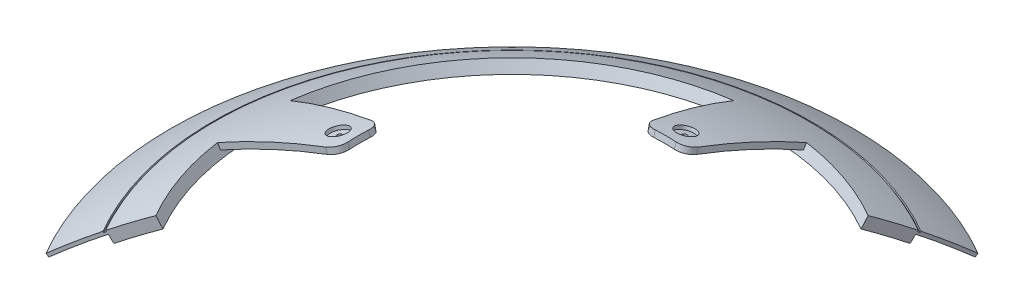
from build123d import *
from build123d.topology import SkipClean

# Parameters (mm, degrees)
REVOLVE1_ANGLE           = 30
REVOLVE1_OTHER_WAY_ANGLE = 120
REVOLVE2_ANGLE           = 15
CIRPATTERN1_COUNT        = 4
REVOLVE4_ANGLE           = 16
CUT_REVOLVE4_START       = -250
CUT_REVOLVE4_OUTLINE_R   = 4
CUT_REVOLVE4_DEPTH       = 1.5
CUT_REVOLVE4_START_2     = -248.5
CUT_REVOLVE4_2_OUTLINE_R = 1
CUT_REVOLVE4_2_DEPTH     = 1.00202
FILLET2_R                = 5
CIRPATTERN5_COUNT        = 2
CIRPATTERN5_ANGLE        = 90
FILLET2_OF_CIRPATTERN5_R = 5


# Read off the part's stored shape, not the designer's step: Revolve2, Revolve4, Cut-Revolve4
with BuildPart() as part:
    # Sketch1 → Revolve1 (revolve)
    with BuildSketch(Plane.XY):
        with BuildLine():
            ThreePointArc((-142.533744, 203.559283), (-133.518953, 209.582774), (-124.25, 215.207313))
            Line((-124.25, 215.207313), (-125, 216.506351))
            ThreePointArc((-125, 216.506351), (-134.324902, 210.847861), (-143.394109, 204.788011))
            Line((-143.394109, 204.788011), (-142.533744, 203.559283))
        make_face()
        with BuildLine():
            ThreePointArc((-124.25, 215.207313), (-64.316533, 240.032568), (0, 248.5))
            Line((0, 248.5), (0, 250))
            ThreePointArc((0, 250), (-64.704761, 241.481457), (-125, 216.506351))
            Line((-125, 216.506351), (-124.25, 215.207313))
        make_face()
        with BuildLine():
            ThreePointArc((-122.5, 212.176224), (-63.410666, 236.651827), (0, 245))
            Line((0, 245), (0, 248.5))
            ThreePointArc((0, 248.5), (-64.316533, 240.032568), (-124.25, 215.207313))
            Line((-124.25, 215.207313), (-122.5, 212.176224))
        make_face()
    revolve(axis=Axis((0, 0, 0), (0, 1, 0)), revolution_arc=REVOLVE1_ANGLE)

    # Sketch1 → Revolve1 other way (revolve)
    with SkipClean():  # the faces are left unmerged after this step: merging them gives an invalid solid
        with BuildSketch(Plane.XY):
            with BuildLine():
                ThreePointArc((-142.533744, 203.559283), (-133.518953, 209.582774), (-124.25, 215.207313))
                Line((-124.25, 215.207313), (-125, 216.506351))
                ThreePointArc((-125, 216.506351), (-134.324902, 210.847861), (-143.394109, 204.788011))
                Line((-143.394109, 204.788011), (-142.533744, 203.559283))
            make_face()
            with BuildLine():
                ThreePointArc((-124.25, 215.207313), (-64.316533, 240.032568), (0, 248.5))
                Line((0, 248.5), (0, 250))
                ThreePointArc((0, 250), (-64.704761, 241.481457), (-125, 216.506351))
                Line((-125, 216.506351), (-124.25, 215.207313))
            make_face()
            with BuildLine():
                ThreePointArc((-122.5, 212.176224), (-63.410666, 236.651827), (0, 245))
                Line((0, 245), (0, 248.5))
                ThreePointArc((0, 248.5), (-64.316533, 240.032568), (-124.25, 215.207313))
                Line((-124.25, 215.207313), (-122.5, 212.176224))
            make_face()
        revolve(axis=Axis((0, 0, 0), (0, -1, 0)), revolution_arc=REVOLVE1_OTHER_WAY_ANGLE)

    # Revolve2 outline → Revolve2 (revolve)
    with SkipClean():  # the faces are left unmerged after this step: merging them gives an invalid solid
        with BuildSketch(Plane(origin=(0, 0, 0), x_dir=(-0.9914448613738103, 0, -0.13052619222005243), z_dir=(0.13052619222005243, 0, -0.9914448613738103))):
            with BuildLine():
                Line((133.4007, 205.497575), (135.306424, 208.433255))
                Line((135.306424, 208.433255), (135.306424, 209.582774))
                Line((135.306424, 209.582774), (133.518953, 209.582774))
                Line((133.518953, 209.582774), (132.713003, 208.317687))
                ThreePointArc((132.713003, 208.317687), (130.890058, 209.46788), (129.057145, 210.602121))
                Line((129.057145, 210.602121), (128.012148, 208.89684))
                ThreePointArc((128.012148, 208.89684), (130.717474, 207.214724), (133.4007, 205.497575))
            make_face()
        revolve2 = revolve(axis=Axis((0, 0, 0), (0, 1, 0)), revolution_arc=REVOLVE2_ANGLE)

    # CirPattern1: Revolve2 ×4 about axis, 2 skipped
    with SkipClean():  # the faces are left unmerged after this step: merging them gives an invalid solid
        cirpattern1_axis = Axis((0, 0, 0), (0, -1, 0))
        add([revolve2.rotate(cirpattern1_axis, i * 360 / CIRPATTERN1_COUNT) for i in range(1, CIRPATTERN1_COUNT) if i not in (2, 3)])

    # Sketch4 → Cut-Revolve1 (revolve, cut)
    with BuildSketch(Plane.XY):
        with BuildLine():
            Line((0, 250), (0, 0))
            Line((0, 0), (109.592787, 224.698512))
            ThreePointArc((109.592787, 224.698512), (56.237764, 243.592516), (0, 250))
        make_face()
    revolve(axis=Axis((0, 0, 0), (0, 1, 0)), mode=Mode.SUBTRACT)

    # Revolve4 outline → Revolve4 (revolve)
    with BuildSketch(Plane(origin=(0, 0, 0), x_dir=(-0.9902680687415703, 0, -0.13917310096006574), z_dir=(0.13917310096006574, 0, -0.9902680687415703))):
        with BuildLine():
            Line((108.496859, 222.451526), (114.084698, 222.451526))
            ThreePointArc((114.084698, 222.451526), (89.899679, 233.276762), (64.704761, 241.481457))
            Line((64.704761, 241.481457), (64.057714, 239.066642))
            ThreePointArc((64.057714, 239.066642), (86.676327, 231.826367), (108.496859, 222.451526))
        make_face()
    revolve4 = revolve(axis=Axis((0, 0, 0), (0, 1, 0)), revolution_arc=REVOLVE4_ANGLE)

    # Cut-Revolve4 outline → Cut-Revolve4 (cut)
    with BuildSketch(Plane(origin=(0, 0, 0), x_dir=(0.956304755963035, 0.29237170472273805, 0), z_dir=(0.29237170472273805, -0.9563047559630351, 0)).offset(CUT_REVOLVE4_START)):
        Circle(CUT_REVOLVE4_OUTLINE_R)
    cut_revolve4 = extrude(amount=CUT_REVOLVE4_DEPTH, mode=Mode.SUBTRACT)

    # Cut-Revolve4 2 outline → Cut-Revolve4 2 (cut)
    with BuildSketch(Plane(origin=(0, 0, 0), x_dir=(0.956304755963035, 0.29237170472273805, 0), z_dir=(0.29237170472273805, -0.9563047559630351, 0)).offset(CUT_REVOLVE4_START_2)):
        Circle(CUT_REVOLVE4_2_OUTLINE_R)
    cut_revolve4_2 = extrude(amount=CUT_REVOLVE4_2_DEPTH, mode=Mode.SUBTRACT)

    # Fillet2
    fillet2_edges = [part.edges().sort_by_distance(p)[0] for p in [
        (-63.754684, 240.274049, -8.960136),
        (-63.754684, 240.274049, 8.960136),
    ]]
    fillet(fillet2_edges, radius=FILLET2_R)

    # CirPattern5: Revolve4, Cut-Revolve4, Cut-Revolve4 2 ×2 about axis
    cirpattern5_axis = Axis((0, 0, 0), (0, -1, 0))
    add([revolve4.rotate(cirpattern5_axis, i * CIRPATTERN5_ANGLE / (CIRPATTERN5_COUNT - 1)) for i in range(1, CIRPATTERN5_COUNT)])
    add([cut_revolve4.rotate(cirpattern5_axis, i * CIRPATTERN5_ANGLE / (CIRPATTERN5_COUNT - 1)) for i in range(1, CIRPATTERN5_COUNT)], mode=Mode.SUBTRACT)
    add([cut_revolve4_2.rotate(cirpattern5_axis, i * CIRPATTERN5_ANGLE / (CIRPATTERN5_COUNT - 1)) for i in range(1, CIRPATTERN5_COUNT)], mode=Mode.SUBTRACT)

    # Fillet2 of CirPattern5
    fillet2_of_cirpattern5_edges = [part.edges().sort_by_distance(p)[0] for p in [
        (8.960136, 240.274049, -63.754684),
        (-8.960136, 240.274049, -63.754684),
    ]]
    fillet(fillet2_of_cirpattern5_edges, radius=FILLET2_OF_CIRPATTERN5_R)

    # Sketch11 → Cut-Revolve5 (revolve, cut)
    with BuildSketch(Plane.XY):
        with BuildLine():
            ThreePointArc((-125.615023, 215.571603), (-125.182763, 215.822904), (-124.75, 216.073338))
            Line((-124.75, 216.073338), (-125, 216.506351))
            ThreePointArc((-125, 216.506351), (-125.432764, 216.255917), (-125.865025, 216.004619))
            Line((-125.865025, 216.004619), (-125.615023, 215.571603))
        make_face()
    revolve(axis=Axis((0, 0, 0), (0, 1, 0)), mode=Mode.SUBTRACT)


solid = part.part
